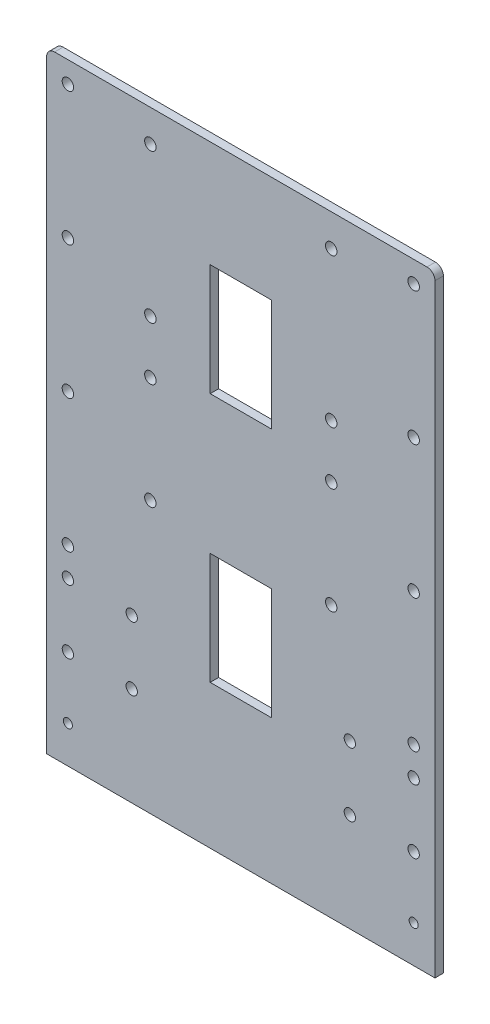
from build123d import *

# Parameters (mm, degrees)
SKETCH1_W           = 146
SKETCH1_H           = 230
SKETCH1_R           = 2.125
SKETCH1_R_2         = 1.7
SKETCH1_R_3         = 2.15
SKETCH1_W_2         = 23
SKETCH1_H_2         = 42
BOSS_EXTRUDE1_DEPTH = 3.175
FILLET1_R           = 3


with BuildPart() as part:
    # Sketch1 → Boss-Extrude1 (new body)
    with BuildSketch(Plane.XY):
        Rectangle(SKETCH1_W, SKETCH1_H)
        with Locations((-65, -77.85)):
            Circle(SKETCH1_R, mode=Mode.SUBTRACT)
        with Locations((-41, -77.85)):
            Circle(SKETCH1_R, mode=Mode.SUBTRACT)
        with Locations((-41, -53.85)):
            Circle(SKETCH1_R, mode=Mode.SUBTRACT)
        with Locations((-65, -53.85)):
            Circle(SKETCH1_R, mode=Mode.SUBTRACT)
        with Locations((41, -77.85)):
            Circle(SKETCH1_R, mode=Mode.SUBTRACT)
        with Locations((65, -77.85)):
            Circle(SKETCH1_R, mode=Mode.SUBTRACT)
        with Locations((65, -53.85)):
            Circle(SKETCH1_R, mode=Mode.SUBTRACT)
        with Locations((41, -53.85)):
            Circle(SKETCH1_R, mode=Mode.SUBTRACT)
        with Locations((-65, -101.025)):
            Circle(SKETCH1_R_2, mode=Mode.SUBTRACT)
        with Locations((65, -101.025)):
            Circle(SKETCH1_R_2, mode=Mode.SUBTRACT)
        with Locations((-34, 103)):
            Circle(SKETCH1_R_3, mode=Mode.SUBTRACT)
        with Locations((-34, 47)):
            Circle(SKETCH1_R_3, mode=Mode.SUBTRACT)
        with Locations((34, 47)):
            Circle(SKETCH1_R_3, mode=Mode.SUBTRACT)
        with Locations((34, 103)):
            Circle(SKETCH1_R_3, mode=Mode.SUBTRACT)
        with Locations((-34, 27)):
            Circle(SKETCH1_R_3, mode=Mode.SUBTRACT)
        with Locations((-65, 107)):
            Circle(SKETCH1_R_3, mode=Mode.SUBTRACT)
        with Locations((-65, 57)):
            Circle(SKETCH1_R_3, mode=Mode.SUBTRACT)
        with Locations((-65, 7)):
            Circle(SKETCH1_R_3, mode=Mode.SUBTRACT)
        with Locations((-65, -43)):
            Circle(SKETCH1_R_3, mode=Mode.SUBTRACT)
        with Locations((65, -43)):
            Circle(SKETCH1_R_3, mode=Mode.SUBTRACT)
        with Locations((65, 7)):
            Circle(SKETCH1_R_3, mode=Mode.SUBTRACT)
        with Locations((65, 57)):
            Circle(SKETCH1_R_3, mode=Mode.SUBTRACT)
        with Locations((65, 107)):
            Circle(SKETCH1_R_3, mode=Mode.SUBTRACT)
        with Locations((-34, -13)):
            Circle(SKETCH1_R_3, mode=Mode.SUBTRACT)
        with Locations((34, -13)):
            Circle(SKETCH1_R_3, mode=Mode.SUBTRACT)
        with Locations((34, 27)):
            Circle(SKETCH1_R_3, mode=Mode.SUBTRACT)
        with Locations((0, 54)):
            Rectangle(SKETCH1_W_2, SKETCH1_H_2, mode=Mode.SUBTRACT)
        with Locations((0, -40)):
            Rectangle(SKETCH1_W_2, SKETCH1_H_2, mode=Mode.SUBTRACT)
    extrude(amount=BOSS_EXTRUDE1_DEPTH)

    # Fillet1
    fillet1_edges = [part.edges().sort_by_distance(p)[0] for p in [
        (73, 115, 1.5875),
        (-73, 115, 1.5875),
    ]]
    fillet(fillet1_edges, radius=FILLET1_R)


solid = part.part
